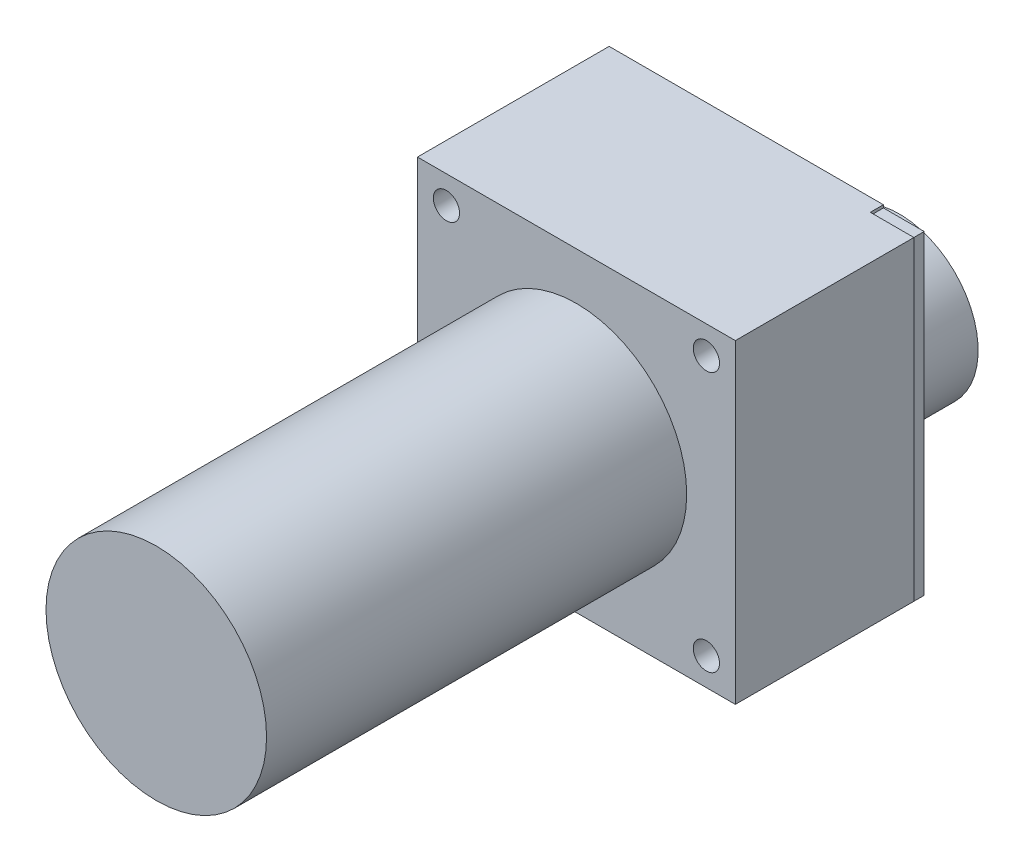
from build123d import *

# Parameters (mm, degrees)
BOSS_EXTRUDE1_DEPTH = 2.5
SKETCH3_W           = 44.463900584
SKETCH3_H           = 3.684459624
SKETCH3_W_2         = 45
SKETCH3_H_2         = 1.418134712
BOSS_EXTRUDE2_DEPTH = 31.5
SKETCH4_W           = 60.536099416
SKETCH4_H           = 60
BOSS_EXTRUDE3_DEPTH = 34
SKETCH5_R           = 21
BOSS_EXTRUDE4_DEPTH = 80
SKETCH6_R           = 4
BOSS_EXTRUDE5_DEPTH = 3
SKETCH7_R           = 15
BOSS_EXTRUDE6_DEPTH = 22
SKETCH13_R          = 2
CUT_EXTRUDE1_DEPTH  = 3
CUT_EXTRUDE2_START  = -3
SKETCH14_R          = 2
CUT_EXTRUDE2_DEPTH  = 3
SKETCH15_R          = 2.5
SKETCH15_W          = 52.231950292
SKETCH15_H          = 11.081865288
SKETCH15_W_2        = 52.768049708
SKETCH15_H_2        = 8.918134712
CUT_EXTRUDE3_DEPTH  = 128.185394164


with BuildPart() as part:
    # Sketch2 → Boss-Extrude1 (new body)
    with BuildSketch(Plane.XY):
        Polygon((-30.268049708, -30), (-30.268049708, 31.081865288), (-22.5, 31.081865288), (-22.5, 41.081865288), (21.963900584, 41.081865288), (21.963900584, 29.468648207), (29.731950292, 29.468648207), (29.731950292, -30.531351793), (22.5, -30.531351793), (22.5, -38.918134712), (-22.5, -38.918134712), (-22.5, -30), align=None)
    extrude(amount=BOSS_EXTRUDE1_DEPTH)

    # Sketch3 → Boss-Extrude2 (add)
    with BuildSketch(Plane.XY.offset(2.5)):
        with Locations((-0.268049708, 39.239635476)):
            Rectangle(SKETCH3_W, SKETCH3_H)
        with Locations((0, -38.209067356)):
            Rectangle(SKETCH3_W_2, SKETCH3_H_2)
    extrude(amount=BOSS_EXTRUDE2_DEPTH)

    # Sketch4 → Boss-Extrude3 (add)
    with BuildSketch(Plane.XY.offset(2.5)):
        Rectangle(SKETCH4_W, SKETCH4_H)
    extrude(amount=BOSS_EXTRUDE3_DEPTH)

    # Sketch5 → Boss-Extrude4 (add)
    with BuildSketch(Plane.XY.offset(36.5)):
        Circle(SKETCH5_R)
    extrude(amount=BOSS_EXTRUDE4_DEPTH)

    # Sketch6 → Boss-Extrude5 (add)
    with BuildSketch(Plane(origin=(0, 0, 0), x_dir=(-1, 0, 0), z_dir=(0, 0, -1))):
        with Locations((0, -10)):
            Circle(SKETCH6_R)
    extrude(amount=BOSS_EXTRUDE5_DEPTH)

    # Sketch7 → Boss-Extrude6 (add)
    with BuildSketch(Plane(origin=(0, 0, -3), x_dir=(-1, 0, 0), z_dir=(0, 0, -1))):
        with Locations((0, -10)):
            Circle(SKETCH7_R)
    extrude(amount=BOSS_EXTRUDE6_DEPTH)

    # Sketch13 → Cut-Extrude1 (cut)
    with BuildSketch(Plane(origin=(0, 41.081865288, 0), x_dir=(1, 0, 0), z_dir=(0, 1, 0))):
        with Locations((-12.5, -14)):
            Circle(SKETCH13_R)
        with Locations((12.5, -14)):
            Circle(SKETCH13_R)
        with Locations((-12.5, -26)):
            Circle(SKETCH13_R)
        with Locations((12.5, -26)):
            Circle(SKETCH13_R)
    extrude(amount=-CUT_EXTRUDE1_DEPTH, mode=Mode.SUBTRACT)

    # Sketch14 → Cut-Extrude2 (cut)
    with BuildSketch(Plane.XZ.offset(38.918134712).offset(CUT_EXTRUDE2_START)):
        with Locations((12.5, 26)):
            Circle(SKETCH14_R)
        with Locations((12.5, 14)):
            Circle(SKETCH14_R)
        with Locations((-12.5, 14)):
            Circle(SKETCH14_R)
        with Locations((-12.5, 26)):
            Circle(SKETCH14_R)
    extrude(amount=CUT_EXTRUDE2_DEPTH, mode=Mode.SUBTRACT)

    # Sketch15 → Cut-Extrude3 (cut, through all)
    with BuildSketch(Plane(origin=(0, 0, 0), x_dir=(-1, 0, 0), z_dir=(0, 0, -1))):
        with Locations((-24.75, 24.75)):
            Circle(SKETCH15_R)
        with Locations((24.75, 24.75)):
            Circle(SKETCH15_R)
        with Locations((24.75, -24.75)):
            Circle(SKETCH15_R)
        with Locations((-24.75, -24.75)):
            Circle(SKETCH15_R)
        with Locations((4.152074562, 35.540932644)):
            Rectangle(SKETCH15_W, SKETCH15_H)
        with Locations((3.884024854, -34.459067356)):
            Rectangle(SKETCH15_W_2, SKETCH15_H_2)
    extrude(amount=-CUT_EXTRUDE3_DEPTH, mode=Mode.SUBTRACT)


solid = part.part
